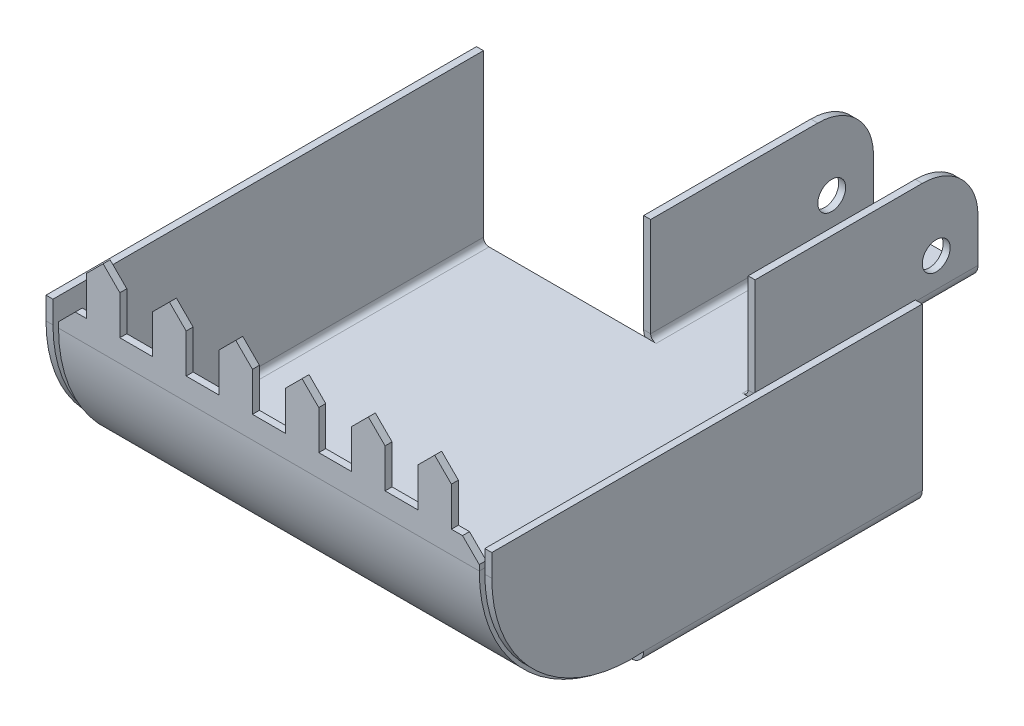
from build123d import *

# Parameters (mm, degrees)
SKETCH1_W                      = 20
SKETCH1_H                      = 40
BASE_FLANGE1_DEPTH             = 1.25
EDGE_FLANGE1_STRIP_W           = 7
EDGE_FLANGE1_STRIP_H           = 1.25
EDGE_FLANGE1_STRIP_CUT_DEPTH   = 40
EDGE_FLANGE1_STRIP_2_W         = 7
EDGE_FLANGE1_STRIP_2_H         = 1.25
EDGE_FLANGE1_STRIP_CUT_2_DEPTH = 40
EDGE_FLANGE1_DEPTH             = 40
EDGE_FLANGE1_BEND_DEPTH        = 40
SKETCH12_W                     = 80
SKETCH12_H                     = 50
TAB1_DEPTH                     = 1.25
EDGE_FLANGE2_STRIP_W           = 7
EDGE_FLANGE2_STRIP_H           = 1.25
EDGE_FLANGE2_STRIP_CUT_DEPTH   = 50
EDGE_FLANGE2_STRIP_2_W         = 7
EDGE_FLANGE2_STRIP_2_H         = 1.25
EDGE_FLANGE2_STRIP_CUT_2_DEPTH = 50
EDGE_FLANGE2_DEPTH             = 50
EDGE_FLANGE2_BEND_DEPTH        = 50
EDGE_FLANGE3_DEPTH             = 75.5
TAB2_DEPTH                     = 1.25
SKETCH27_W                     = 6
SKETCH27_H                     = 10
TAB3_DEPTH                     = 1.25
BREAK_CORNER1_START            = 76
BREAK_CORNER1_DEPTH            = 1.25
CUT_EXTRUDE1_REACH             = 102.337
SKETCH30_R                     = 2.5
FILLET1_R                      = 10


# Read off the part's stored shape, not the designer's step: Break-Corner1
# Sheet-metal steps are written as plain solids
with BuildPart() as part:
    # Sketch1 → Base-Flange1 (new body)
    with BuildSketch(Plane(origin=(0, 0, 0), x_dir=(1, 0, 0), z_dir=(0, 1, 0))):
        with Locations((0, 20)):
            Rectangle(SKETCH1_W, SKETCH1_H)
    extrude(amount=-BASE_FLANGE1_DEPTH)

    # Edge-Flange1 strip (across the edge) → Edge-Flange1 strip cut (cut)
    with BuildSketch(Plane(origin=(10, 0, 0), x_dir=(-1, 0, 0), z_dir=(0, 0, -1))):
        with Locations((-1.25, -0.625)):
            Rectangle(EDGE_FLANGE1_STRIP_W, EDGE_FLANGE1_STRIP_H)
    extrude(amount=EDGE_FLANGE1_STRIP_CUT_DEPTH, mode=Mode.SUBTRACT)

    # Edge-Flange1 strip 2 (across the edge) → Edge-Flange1 strip cut 2 (cut)
    with BuildSketch(Plane(origin=(-10, 0, -40), x_dir=(1, 0, 0), z_dir=(0, 0, 1))):
        with Locations((-1.25, -0.625)):
            Rectangle(EDGE_FLANGE1_STRIP_2_W, EDGE_FLANGE1_STRIP_2_H)
    extrude(amount=EDGE_FLANGE1_STRIP_CUT_2_DEPTH, mode=Mode.SUBTRACT)

    # Edge-Flange1 section (across the edge) → Edge-Flange1 (add)
    with BuildSketch(Plane(origin=(10, 0, 0), x_dir=(-1, 0, 0), z_dir=(0, 0, -1))):
        with BuildLine():
            Line((0, 1), (0, 18.75))
            Line((0, 18.75), (1.25, 18.75))
            Line((1.25, 18.75), (1.25, 1))
            ThreePointArc((1.25, 1), (1.542893219, 0.292893219), (2.25, 0))
            Line((2.25, 0), (2.25, -1.25))
            ThreePointArc((2.25, -1.25), (0.659009742, -0.590990258), (0, 1))
        make_face()
    extrude(amount=EDGE_FLANGE1_DEPTH)

    # Edge-Flange1 section 2 (across the edge) → Edge-Flange1 bend (add)
    with BuildSketch(Plane(origin=(-10, 0, -40), x_dir=(1, 0, 0), z_dir=(0, 0, 1))):
        with BuildLine():
            Line((0, 1), (0, 18.75))
            Line((0, 18.75), (1.25, 18.75))
            Line((1.25, 18.75), (1.25, 1))
            ThreePointArc((1.25, 1), (1.542893219, 0.292893219), (2.25, 0))
            Line((2.25, 0), (2.25, -1.25))
            ThreePointArc((2.25, -1.25), (0.659009742, -0.590990258), (0, 1))
        make_face()
    extrude(amount=EDGE_FLANGE1_BEND_DEPTH)

    # Sketch12 → Tab1 (add)
    with BuildSketch(Plane.XZ.offset(1.25)):
        with Locations((0, 25)):
            Rectangle(SKETCH12_W, SKETCH12_H)
    extrude(amount=-TAB1_DEPTH)

    # Edge-Flange2 strip (across the edge) → Edge-Flange2 strip cut (cut)
    with BuildSketch(Plane(origin=(40, 0, 50), x_dir=(-1, 0, 0), z_dir=(0, 0, -1))):
        with Locations((-1.25, -0.625)):
            Rectangle(EDGE_FLANGE2_STRIP_W, EDGE_FLANGE2_STRIP_H)
    extrude(amount=EDGE_FLANGE2_STRIP_CUT_DEPTH, mode=Mode.SUBTRACT)

    # Edge-Flange2 strip 2 (across the edge) → Edge-Flange2 strip cut 2 (cut)
    with BuildSketch(Plane(origin=(-40, 0, 0), x_dir=(1, 0, 0), z_dir=(0, 0, 1))):
        with Locations((-1.25, -0.625)):
            Rectangle(EDGE_FLANGE2_STRIP_2_W, EDGE_FLANGE2_STRIP_2_H)
    extrude(amount=EDGE_FLANGE2_STRIP_CUT_2_DEPTH, mode=Mode.SUBTRACT)

    # Edge-Flange2 section (across the edge) → Edge-Flange2 (add)
    with BuildSketch(Plane(origin=(40, 0, 50), x_dir=(-1, 0, 0), z_dir=(0, 0, -1))):
        with BuildLine():
            Line((0, 1), (0, 30))
            Line((0, 30), (1.25, 30))
            Line((1.25, 30), (1.25, 1))
            ThreePointArc((1.25, 1), (1.542893219, 0.292893219), (2.25, 0))
            Line((2.25, 0), (2.25, -1.25))
            ThreePointArc((2.25, -1.25), (0.659009742, -0.590990258), (0, 1))
        make_face()
    extrude(amount=EDGE_FLANGE2_DEPTH)

    # Edge-Flange2 section 2 (across the edge) → Edge-Flange2 bend (add)
    with BuildSketch(Plane(origin=(-40, 0, 0), x_dir=(1, 0, 0), z_dir=(0, 0, 1))):
        with BuildLine():
            Line((0, 1), (0, 30))
            Line((0, 30), (1.25, 30))
            Line((1.25, 30), (1.25, 1))
            ThreePointArc((1.25, 1), (1.542893219, 0.292893219), (2.25, 0))
            Line((2.25, 0), (2.25, -1.25))
            ThreePointArc((2.25, -1.25), (0.659009742, -0.590990258), (0, 1))
        make_face()
    extrude(amount=EDGE_FLANGE2_BEND_DEPTH)

    # Edge-Flange3 section (across the edge) → Edge-Flange3 (add)
    with BuildSketch(Plane(origin=(-37.75, 0, 76), x_dir=(0, 0, -1), z_dir=(1, 0, 0))):
        with BuildLine():
            Line((-1.25, 26), (-1.25, 30))
            Line((-1.25, 30), (0, 30))
            Line((0, 30), (0, 26))
            ThreePointArc((0, 26), (7.615223689, 7.615223689), (26, 0))
            Line((26, 0), (26, -1.25))
            ThreePointArc((26, -1.25), (6.731340213, 6.731340213), (-1.25, 26))
        make_face()
    extrude(amount=EDGE_FLANGE3_DEPTH)

    # Sketch24 → Tab2 (add)
    with BuildSketch(Plane(origin=(40, 0, 0), x_dir=(0, 0, -1), z_dir=(1, 0, 0))):
        with BuildLine():
            Line((-50, 30), (-77.25, 30))
            Line((-77.25, 30), (-77.25, 26))
            ThreePointArc((-77.25, 26), (-69.120673955, 7.509715389), (-50, 1))
            Line((-50, 1), (-50, 30))
        make_face()
    tab2 = extrude(amount=-TAB2_DEPTH)

    # Mirror1: Tab2 across plane
    add(tab2.mirror(Plane(origin=(0, 0, 0), x_dir=(0, 0, 1), z_dir=(1, 0, 0))))

    # Sketch27 → Tab3 (add)
    with BuildSketch(Plane.XY.offset(77.25)):
        with Locations((-29.75, 35)):
            Rectangle(SKETCH27_W, SKETCH27_H)
        with Locations((-17.85, 35)):
            Rectangle(SKETCH27_W, SKETCH27_H)
        with Locations((-5.95, 35)):
            Rectangle(SKETCH27_W, SKETCH27_H)
        with Locations((5.95, 35)):
            Rectangle(SKETCH27_W, SKETCH27_H)
        with Locations((17.85, 35)):
            Rectangle(SKETCH27_W, SKETCH27_H)
        with Locations((29.75, 35)):
            Rectangle(SKETCH27_W, SKETCH27_H)
    extrude(amount=-TAB3_DEPTH)

    # Break-Corner1 outline → Break-Corner1 (cut)
    with BuildSketch(Plane.XY.offset(BREAK_CORNER1_START)):
        Polygon((-37.75, 30), (-37.75, 27), (-34.75, 30), align=None)
        Polygon((-26.75, 40), (-29.75, 40), (-26.75, 37), align=None)
        Polygon((-32.75, 40), (-32.75, 37), (-29.75, 40), align=None)
        Polygon((-20.85, 40), (-20.85, 37), (-17.85, 40), align=None)
        Polygon((-14.85, 40), (-17.85, 40), (-14.85, 37), align=None)
        Polygon((-8.95, 40), (-8.95, 37), (-5.95, 40), align=None)
        Polygon((-2.95, 40), (-5.95, 40), (-2.95, 37), align=None)
        Polygon((2.95, 40), (2.95, 37), (5.95, 40), align=None)
        Polygon((8.95, 40), (5.95, 40), (8.95, 37), align=None)
        Polygon((14.85, 40), (14.85, 37), (17.85, 40), align=None)
        Polygon((20.85, 40), (17.85, 40), (20.85, 37), align=None)
        Polygon((26.75, 40), (26.75, 37), (29.75, 40), align=None)
        Polygon((37.75, 30), (34.75, 30), (37.75, 27), align=None)
        Polygon((32.75, 40), (29.75, 40), (32.75, 37), align=None)
    extrude(amount=BREAK_CORNER1_DEPTH, mode=Mode.SUBTRACT)

    # Cut-Extrude1: up to this face of the body (flat: up to its plane)
    cut_extrude1_end = Plane(part.part.faces().sort_by_distance((-10, 9.875, -20))[0])
    # Sketch30 → Cut-Extrude1 (cut, up to the picked face)
    with BuildSketch(Plane(origin=(10, 0, 0), x_dir=(0, 0, -1), z_dir=(1, 0, 0)), mode=Mode.PRIVATE) as cut_extrude1_sk1:
        with Locations(Location((32.5, 6.25, 0), (0, 0, 90))):
            Circle(SKETCH30_R)
    cut_extrude1_tool1 = split(extrude(cut_extrude1_sk1.sketch, amount=-CUT_EXTRUDE1_REACH, mode=Mode.PRIVATE), bisect_by=cut_extrude1_end, keep=Keep.BOTH, mode=Mode.PRIVATE)
    add(cut_extrude1_tool1.solids().sort_by(Axis((10, 6.25, -32.5), (-1, 0, 0)))[0], mode=Mode.SUBTRACT)

    # Fillet1
    fillet1_edges = [part.edges().sort_by_distance(p)[0] for p in [
        (9.375, 18.75, -40),
        (-9.375, 18.75, -40),
    ]]
    fillet(fillet1_edges, radius=FILLET1_R)


solid = part.part
